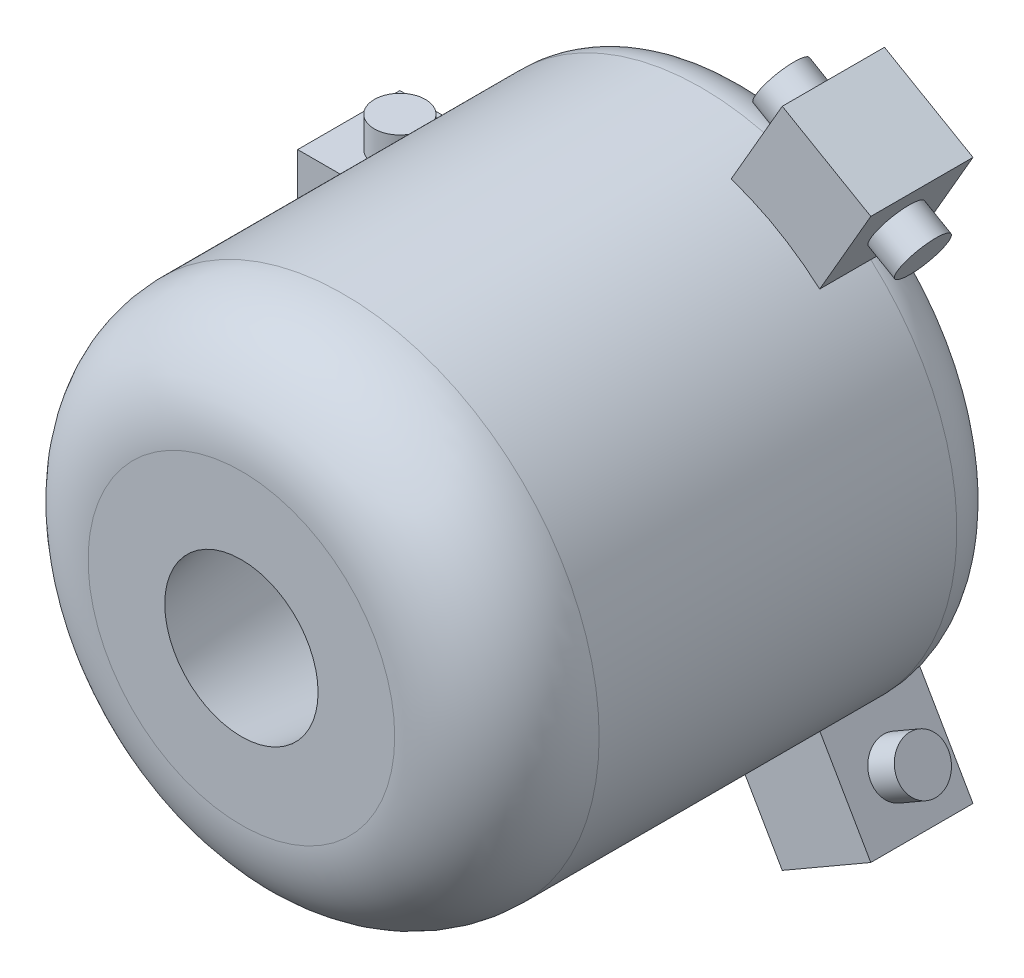
from build123d import *

# Parameters (mm, degrees)
SKETCH1_R           = 25
BOSS_EXTRUDE1_DEPTH = 50
SKETCH2_W           = 10
SKETCH2_H           = 10
BOSS_EXTRUDE2_DEPTH = 10
SKETCH3_R           = 2.5
BOSS_EXTRUDE3_DEPTH = 3
BOSS_EXTRUDE4_START = 3
SKETCH4_R           = 2.5
BOSS_EXTRUDE4_DEPTH = 3
CIRPATTERN1_COUNT   = 3
SKETCH5_R           = 7.5
SKETCH6_R           = 15
FILLET1_R           = 10
FILLET2_R           = 5


with BuildPart() as part:
    # Sketch1 → Boss-Extrude1 (new body)
    with BuildSketch(Plane.XY):
        Circle(SKETCH1_R)
    extrude(amount=BOSS_EXTRUDE1_DEPTH)

    # Sketch2 → Boss-Extrude2 (add)
    with BuildSketch(Plane(origin=(0, 0, 0), x_dir=(-1, 0, 0), z_dir=(0, 0, -1))):
        with Locations((29.494897428, 0)):
            Rectangle(SKETCH2_W, SKETCH2_H)
    boss_extrude2 = extrude(amount=-BOSS_EXTRUDE2_DEPTH)

    # Sketch3 → Boss-Extrude3 (add)
    with BuildSketch(Plane.XZ.offset(5)):
        with Locations((-29.494897428, 5)):
            Circle(SKETCH3_R)
    boss_extrude3 = extrude(amount=BOSS_EXTRUDE3_DEPTH)

    # Sketch4 → Boss-Extrude4 (add)
    with BuildSketch(Plane(origin=(0, 5, 0), x_dir=(1, 0, 0), z_dir=(0, 1, 0)).offset(BOSS_EXTRUDE4_START)):
        with Locations((-29.494897428, -5)):
            Circle(SKETCH4_R)
    boss_extrude4 = extrude(amount=-BOSS_EXTRUDE4_DEPTH)

    # CirPattern1: Boss-Extrude2, Boss-Extrude3, Boss-Extrude4 ×3 about axis
    cirpattern1_axis = Axis((0, 0, 0), (0, 0, 1))
    add([boss_extrude2.rotate(cirpattern1_axis, i * 360 / CIRPATTERN1_COUNT) for i in range(1, CIRPATTERN1_COUNT)])
    add([boss_extrude3.rotate(cirpattern1_axis, i * 360 / CIRPATTERN1_COUNT) for i in range(1, CIRPATTERN1_COUNT)])
    add([boss_extrude4.rotate(cirpattern1_axis, i * 360 / CIRPATTERN1_COUNT) for i in range(1, CIRPATTERN1_COUNT)])

    # Sketch5 → Cut-Loft1 section 0
    with BuildSketch(Plane.XY.offset(50)):
        Circle(SKETCH5_R)
    # Sketch6 → Cut-Loft1 section 1
    with BuildSketch(Plane(origin=(0, 0, 0), x_dir=(-1, 0, 0), z_dir=(0, 0, -1))):
        Circle(SKETCH6_R)
    loft(mode=Mode.SUBTRACT)

    # Fillet1
    fillet1_edges = [part.edges().sort_by_distance(p)[0] for p in [
        (-25, 0, 50),
    ]]
    fillet(fillet1_edges, radius=FILLET1_R)

    # Fillet2
    # the kernel refuses this fillet: 5 mm, written as the material it takes off along each edge
    with BuildSketch(Plane(origin=(0, 0, 0), x_dir=(0.22300738877667003, -0.9748167543446364, 0), z_dir=(-0.9748167543446364, -0.22300738877667003, 0))) as fillet2_piece_1_section:
        with BuildLine():
            CenterArc((25 - FILLET2_R, FILLET2_R), FILLET2_R, 270, 90)
            Line((25 - FILLET2_R, 0), (25, 0))
            Line((25, 0), (25, FILLET2_R))
        make_face()
    fillet2_piece_1 = revolve(axis=Axis((0, 0, 0), (0, 0, 1)), revolution_arc=77.11426693, mode=Mode.PRIVATE)
    fillet2_piece_1 = split(fillet2_piece_1, bisect_by=Plane(origin=(7.29782447, -22.640202767, 1.23109977), z_dir=(-0.8660254037844394, -0.49999999999999883, 0)), keep=Keep.TOP, mode=Mode.PRIVATE)
    add(fillet2_piece_1, mode=Mode.SUBTRACT)
    with BuildSketch(Plane(origin=(0, 0, 0), x_dir=(0.22300738877667003, -0.9748167543446364, 0), z_dir=(-0.9748167543446364, -0.22300738877667003, 0))) as fillet2_piece_2_section:
        with BuildLine():
            CenterArc((25 - FILLET2_R, FILLET2_R), FILLET2_R, 270, 90)
            Line((25 - FILLET2_R, 0), (25, 0))
            Line((25, 0), (25, FILLET2_R))
        make_face()
    fillet2_piece_2 = revolve(axis=Axis((0, 0, 0), (0, 0, 1)), revolution_arc=77.11426693, mode=Mode.PRIVATE)
    fillet2_piece_2 = split(fillet2_piece_2, bisect_by=Plane(origin=(13.725987665, -13.77410802, 1.168109868), z_dir=(0.8660254037844394, 0.4999999999999987, 0)), keep=Keep.TOP, mode=Mode.PRIVATE)
    add(fillet2_piece_2, mode=Mode.SUBTRACT)
    with BuildSketch(Plane(origin=(0, 0, 0), x_dir=(0.732831285228025, 0.68041039629847, 0), z_dir=(0.68041039629847, -0.732831285228025, 0))) as fillet2_piece_3_section:
        with BuildLine():
            CenterArc((25 - FILLET2_R, FILLET2_R), FILLET2_R, 270, 90)
            Line((25 - FILLET2_R, 0), (25, 0))
            Line((25, 0), (25, FILLET2_R))
        make_face()
    fillet2_piece_3 = revolve(axis=Axis((0, 0, 0), (0, 0, 1)), revolution_arc=154.248557626, mode=Mode.PRIVATE)
    fillet2_piece_3 = split(fillet2_piece_3, bisect_by=Plane(origin=(15.957681681, 17.639515442, 1.230959753), z_dir=(0.8660254037844378, -0.5000000000000014, 0)), keep=Keep.TOP, mode=Mode.PRIVATE)
    add(fillet2_piece_3, mode=Mode.SUBTRACT)
    with BuildSketch(Plane(origin=(0, 0, 0), x_dir=(0.732831285228025, 0.68041039629847, 0), z_dir=(0.68041039629847, -0.732831285228025, 0))) as fillet2_piece_4_section:
        with BuildLine():
            CenterArc((25 - FILLET2_R, FILLET2_R), FILLET2_R, 270, 90)
            Line((25 - FILLET2_R, 0), (25, 0))
            Line((25, 0), (25, FILLET2_R))
        make_face()
    fillet2_piece_4 = revolve(axis=Axis((0, 0, 0), (0, 0, 1)), revolution_arc=154.248557626, mode=Mode.PRIVATE)
    fillet2_piece_4 = split(fillet2_piece_4, bisect_by=Plane(origin=(1.564958422, 12.710587499, 1.419658234), z_dir=(-0.8660254037844378, 0.5000000000000017, 0)), keep=Keep.TOP, mode=Mode.PRIVATE)
    fillet2_piece_4 = split(fillet2_piece_4, bisect_by=Plane(origin=(-11.790170883, 5, 1.419658234), z_dir=(0, 1, 0)), keep=Keep.TOP, mode=Mode.PRIVATE)
    add(fillet2_piece_4, mode=Mode.SUBTRACT)
    with BuildSketch(Plane(origin=(0, 0, 0), x_dir=(0.732831285228025, 0.68041039629847, 0), z_dir=(0.68041039629847, -0.732831285228025, 0))) as fillet2_piece_5_section:
        with BuildLine():
            CenterArc((25 - FILLET2_R, FILLET2_R), FILLET2_R, 270, 90)
            Line((25 - FILLET2_R, 0), (25, 0))
            Line((25, 0), (25, FILLET2_R))
        make_face()
    fillet2_piece_5 = revolve(axis=Axis((0, 0, 0), (0, 0, 1)), revolution_arc=154.248557626, mode=Mode.PRIVATE)
    fillet2_piece_5 = split(fillet2_piece_5, bisect_by=Plane(origin=(-23.255109262, -5, 1.230959847), z_dir=(0, -1, 0)), keep=Keep.TOP, mode=Mode.PRIVATE)
    add(fillet2_piece_5, mode=Mode.SUBTRACT)
    with BuildSketch(Plane(origin=(0, 0, 0), x_dir=(-0.9556683308075251, 0.29444531154623416, 0), z_dir=(0.29444531154623416, 0.9556683308075251, 0))) as fillet2_piece_6_section:
        with BuildLine():
            CenterArc((25 - FILLET2_R, FILLET2_R), FILLET2_R, 270, 90)
            Line((25 - FILLET2_R, 0), (25, 0))
            Line((25, 0), (25, FILLET2_R))
        make_face()
    fillet2_piece_6 = revolve(axis=Axis((0, 0, 0), (0, 0, 1)), revolution_arc=154.248557626, mode=Mode.PRIVATE)
    fillet2_piece_6 = split(fillet2_piece_6, bisect_by=Plane(origin=(-23.255109324, 5, 1.230959753), z_dir=(0, 1, 0)), keep=Keep.TOP, mode=Mode.PRIVATE)
    add(fillet2_piece_6, mode=Mode.SUBTRACT)
    with BuildSketch(Plane(origin=(0, 0, 0), x_dir=(-0.9556683308075251, 0.29444531154623416, 0), z_dir=(0.29444531154623416, 0.9556683308075251, 0))) as fillet2_piece_7_section:
        with BuildLine():
            CenterArc((25 - FILLET2_R, FILLET2_R), FILLET2_R, 270, 90)
            Line((25 - FILLET2_R, 0), (25, 0))
            Line((25, 0), (25, FILLET2_R))
        make_face()
    fillet2_piece_7 = revolve(axis=Axis((0, 0, 0), (0, 0, 1)), revolution_arc=154.248557626, mode=Mode.PRIVATE)
    fillet2_piece_7 = split(fillet2_piece_7, bisect_by=Plane(origin=(1.564958422, -12.710587499, 1.419658234), z_dir=(-0.8660254037844394, -0.49999999999999883, 0)), keep=Keep.TOP, mode=Mode.PRIVATE)
    fillet2_piece_7 = split(fillet2_piece_7, bisect_by=Plane(origin=(-11.790170883, -5, 1.419658234), z_dir=(0, -1, 0)), keep=Keep.TOP, mode=Mode.PRIVATE)
    add(fillet2_piece_7, mode=Mode.SUBTRACT)
    with BuildSketch(Plane(origin=(0, 0, 0), x_dir=(-0.9556683308075251, 0.29444531154623416, 0), z_dir=(0.29444531154623416, 0.9556683308075251, 0))) as fillet2_piece_8_section:
        with BuildLine():
            CenterArc((25 - FILLET2_R, FILLET2_R), FILLET2_R, 270, 90)
            Line((25 - FILLET2_R, 0), (25, 0))
            Line((25, 0), (25, FILLET2_R))
        make_face()
    fillet2_piece_8 = revolve(axis=Axis((0, 0, 0), (0, 0, 1)), revolution_arc=154.248557626, mode=Mode.PRIVATE)
    fillet2_piece_8 = split(fillet2_piece_8, bisect_by=Plane(origin=(15.95768165, -17.639515389, 1.230959847), z_dir=(0.8660254037844394, 0.4999999999999987, 0)), keep=Keep.TOP, mode=Mode.PRIVATE)
    add(fillet2_piece_8, mode=Mode.SUBTRACT)
    with BuildSketch(Plane(origin=(0, 0, 0), x_dir=(1, 0, 0), z_dir=(0, -1, 0))) as fillet2_piece_9_section:
        with BuildLine():
            CenterArc((25 - FILLET2_R, FILLET2_R), FILLET2_R, 270, 90)
            Line((25 - FILLET2_R, 0), (25, 0))
            Line((25, 0), (25, FILLET2_R))
        make_face()
    fillet2_piece_9 = revolve(axis=Axis((0, 0, 0), (0, 0, 1)), revolution_arc=77.11426693, mode=Mode.PRIVATE)
    fillet2_piece_9 = split(fillet2_piece_9, bisect_by=Plane(origin=(13.725987546, 13.774107814, 1.168109699), z_dir=(0.8660254037844378, -0.5000000000000014, 0)), keep=Keep.TOP, mode=Mode.PRIVATE)
    add(fillet2_piece_9, mode=Mode.SUBTRACT)
    with BuildSketch(Plane(origin=(0, 0, 0), x_dir=(1, 0, 0), z_dir=(0, -1, 0))) as fillet2_piece_10_section:
        with BuildLine():
            CenterArc((25 - FILLET2_R, FILLET2_R), FILLET2_R, 270, 90)
            Line((25 - FILLET2_R, 0), (25, 0))
            Line((25, 0), (25, FILLET2_R))
        make_face()
    fillet2_piece_10 = revolve(axis=Axis((0, 0, 0), (0, 0, 1)), revolution_arc=77.11426693, mode=Mode.PRIVATE)
    fillet2_piece_10 = split(fillet2_piece_10, bisect_by=Plane(origin=(7.297824439, 22.640202713, 1.231099864), z_dir=(-0.8660254037844378, 0.5000000000000017, 0)), keep=Keep.TOP, mode=Mode.PRIVATE)
    add(fillet2_piece_10, mode=Mode.SUBTRACT)


solid = part.part
